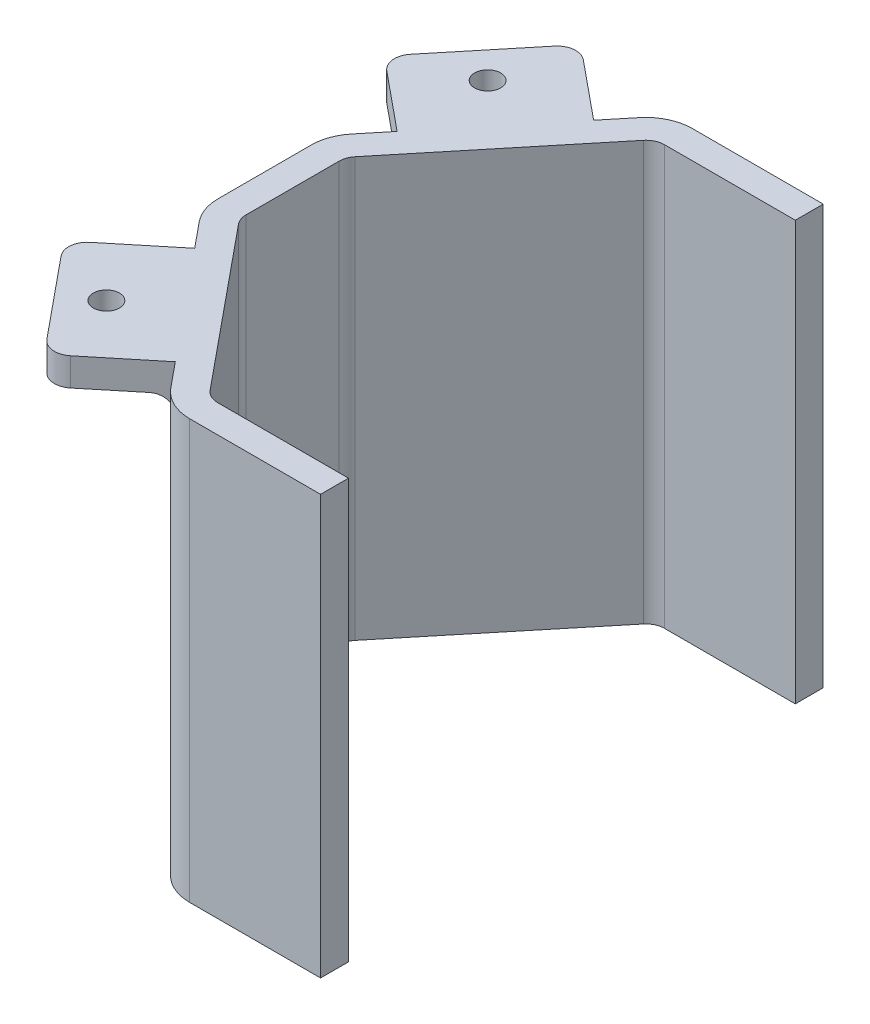
from build123d import *

# Parameters (mm, degrees)
BOSS_EXTRUDE1_DEPTH = 45
BOSS_EXTRUDE2_DEPTH = 3
FILLET1_R           = 2
SKETCH5_R           = 1.4
CUT_EXTRUDE1_DEPTH  = 68.3348504


with BuildPart() as part:
    # Sketch3 → Boss-Extrude1 (new body)
    with BuildSketch(Plane(origin=(0, 0, 0), x_dir=(1, 0, 0), z_dir=(0, 1, 0))):
        with BuildLine():
            Line((-8, 24), (-22.053839059, 24))
            ThreePointArc((-22.053839059, 24), (-22.90912017, 23.807897735), (-23.600099843, 23.268494221))
            Line((-23.600099843, 23.268494221), (-37.546260784, 6.268494221))
            ThreePointArc((-37.546260784, 6.268494221), (-37.883151822, 5.673601675), (-38, 5))
            Line((-38, 5), (-38, -5))
            ThreePointArc((-38, -5), (-37.883151822, -5.673601675), (-37.546260784, -6.268494221))
            Line((-37.546260784, -6.268494221), (-23.600099843, -23.268494221))
            ThreePointArc((-23.600099843, -23.268494221), (-22.90912017, -23.807897735), (-22.053839059, -24))
            Line((-22.053839059, -24), (-8, -24))
            Line((-8, -24), (-8, -27))
            Line((-8, -27), (-22.053839059, -27))
            ThreePointArc((-22.053839059, -27), (-24.192041837, -26.519744338), (-25.919491019, -25.171235552))
            Line((-25.919491019, -25.171235552), (-39.86565196, -8.171235552))
            ThreePointArc((-39.86565196, -8.171235552), (-40.707879555, -6.684004186), (-41, -5))
            Line((-41, -5), (-41, 5))
            ThreePointArc((-41, 5), (-40.707879555, 6.684004186), (-39.86565196, 8.171235552))
            Line((-39.86565196, 8.171235552), (-25.919491019, 25.171235552))
            ThreePointArc((-25.919491019, 25.171235552), (-24.192041837, 26.519744338), (-22.053839059, 27))
            Line((-22.053839059, 27), (-8, 27))
            Line((-8, 27), (-8, 24))
        make_face()
    extrude(amount=BOSS_EXTRUDE1_DEPTH)

    # Sketch4 → Boss-Extrude2 (add)
    with BuildSketch(Plane.XZ.offset(-45)):
        Polygon((-28.135718162, 22.469713492), (-35.867022082, 28.812184595), (-45.380728737, 17.215228715), (-37.649424817, 10.872757612), align=None)
        Polygon((-37.649424817, -10.872757612), (-45.380728737, -17.215228715), (-35.867022082, -28.812184595), (-28.135718162, -22.469713492), align=None)
    extrude(amount=BOSS_EXTRUDE2_DEPTH)

    # Fillet1
    fillet1_edges = [part.edges().sort_by_distance(p)[0] for p in [
        (-32.892571489, 42, -16.671235552),
        (-35.867022082, 43.5, -28.812184595),
        (-45.380728737, 43.5, -17.215228715),
        (-32.892571489, 42, 16.671235552),
        (-35.867022082, 43.5, 28.812184595),
        (-45.380728737, 43.5, 17.215228715),
    ]]
    fillet(fillet1_edges, radius=FILLET1_R)

    # Sketch5 → Cut-Extrude1 (cut, through all)
    with BuildSketch(Plane.XZ.offset(-42)):
        with Locations((-37.531353842, 20.476718214)):
            Circle(SKETCH5_R)
    cut_extrude1 = extrude(amount=-CUT_EXTRUDE1_DEPTH, mode=Mode.SUBTRACT)

    # Mirror1: Cut-Extrude1 across plane
    add(cut_extrude1.mirror(Plane.XY), mode=Mode.SUBTRACT)


solid = part.part
